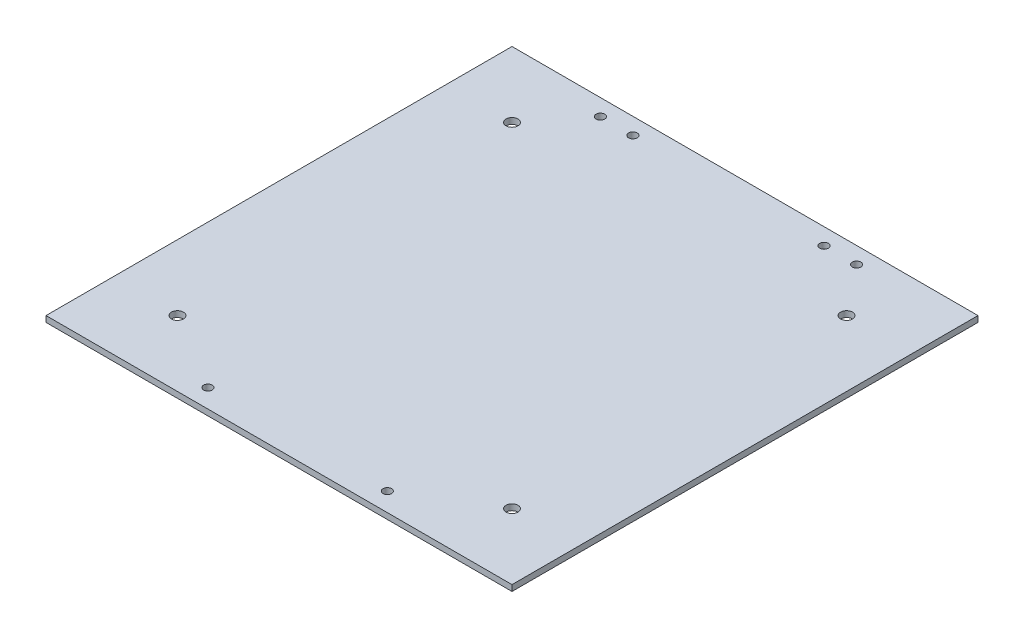
from build123d import *

# Parameters (mm, degrees)
SKETCH1_W           = 247.65
SKETCH1_H           = 247.65
BOSS_EXTRUDE1_DEPTH = 3.175
SKETCH2_R           = 2.286
CUT_EXTRUDE1_DEPTH  = 351.244379862
SKETCH3_R           = 3.175
CUT_EXTRUDE2_DEPTH  = 351.244379862


with BuildPart() as part:
    # Sketch1 → Boss-Extrude1 (new body)
    with BuildSketch(Plane(origin=(0, 0, 0), x_dir=(1, 0, 0), z_dir=(0, 1, 0))):
        with Locations((123.825, 123.825)):
            Rectangle(SKETCH1_W, SKETCH1_H)
    extrude(amount=BOSS_EXTRUDE1_DEPTH)

    # Sketch2 → Cut-Extrude1 (cut, through all)
    with BuildSketch(Plane(origin=(0, 3.175, 0), x_dir=(1, 0, 0), z_dir=(0, 1, 0))):
        with Locations((55.753, 238.8616)):
            Circle(SKETCH2_R)
        with Locations((73.025, 238.8616)):
            Circle(SKETCH2_R)
        with Locations((174.625, 238.8616)):
            Circle(SKETCH2_R)
        with Locations((191.897, 238.8616)):
            Circle(SKETCH2_R)
        with Locations((76.15682, 9.906)):
            Circle(SKETCH2_R)
        with Locations((171.49318, 9.906)):
            Circle(SKETCH2_R)
    extrude(amount=-CUT_EXTRUDE1_DEPTH, mode=Mode.SUBTRACT)

    # Sketch3 → Cut-Extrude2 (cut, through all)
    with BuildSketch(Plane(origin=(0, 3.175, 0), x_dir=(1, 0, 0), z_dir=(0, 1, 0))):
        with Locations((212.725, 212.725)):
            Circle(SKETCH3_R)
        with Locations((212.725, 34.925)):
            Circle(SKETCH3_R)
        with Locations((34.925, 34.925)):
            Circle(SKETCH3_R)
        with Locations((34.925, 212.725)):
            Circle(SKETCH3_R)
    extrude(amount=-CUT_EXTRUDE2_DEPTH, mode=Mode.SUBTRACT)


solid = part.part
